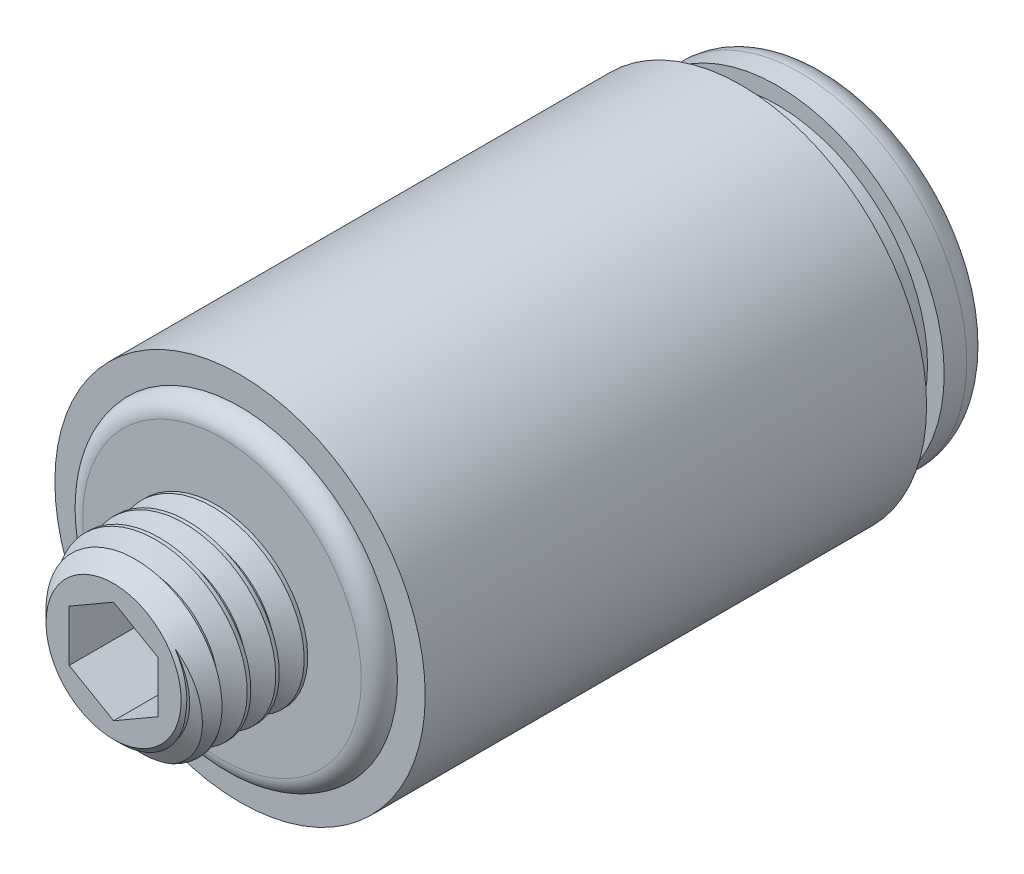
from build123d import *

# Parameters (mm, degrees)
SKETCH9_W          = 3.556
SKETCH9_H          = 2.5
CHAMFER1_SIZE      = 0.6
CUT_SWEEP2_PITCH   = 0.8
CUT_EXTRUDE1_DEPTH = 22.374518802


with BuildPart() as part:
    # Sketch8 → Revolve1 (revolve)
    with BuildSketch(Plane(origin=(0, 0, 0), x_dir=(0, 0, -1), z_dir=(1, 0, 0)), mode=Mode.PRIVATE) as revolve1_sk:
        with BuildLine():
            Line((18.669, 4.6863), (19.304, 4.6863))
            ThreePointArc((19.304, 4.6863), (19.842815367, 4.463115367), (20.066, 3.9243))
            Line((20.066, 3.9243), (20.066, 3.556))
            Line((20.066, 3.556), (19.685, 3.175))
            Line((19.685, 3.175), (3.556, 3.175))
            Line((3.556, 3.175), (3.556, 5.207))
            Line((3.556, 5.207), (17.653, 5.207))
            Line((17.653, 5.207), (17.653, 4.21767))
            Line((17.653, 4.21767), (18.669, 4.21767))
            Line((18.669, 4.21767), (18.669, 4.6863))
        make_face()
    revolve(revolve1_sk.sketch.rotate(Axis((0, 0, 0), (0, 0, -1)), 90), axis=Axis((0, 0, 0), (0, 0, -1)))



with BuildPart() as body_2:
    # Sketch9 → Revolve2 (revolve)
    with BuildSketch(Plane(origin=(0, 0, 0), x_dir=(0, 0, -1), z_dir=(1, 0, 0)), mode=Mode.PRIVATE) as revolve2_sk:
        with Locations((1.778, 1.25)):
            Rectangle(SKETCH9_W, SKETCH9_H)
    revolve(revolve2_sk.sketch.rotate(Axis((0, 0, 0), (0, 0, -1)), 90), axis=Axis((0, 0, 0), (0, 0, -1)))

    # Chamfer1
    chamfer1_edges = [body_2.edges().sort_by_distance(p)[0] for p in [
        (-2.5, 0, 0),
    ]]
    chamfer(chamfer1_edges, length=CHAMFER1_SIZE)

    # Cut-Sweep2: the profile of Sketch11 profile screwed along a right-hand helix of 5.445 turns, 8 arcs to a turn; built about Z, then put on its axis
    cut_sweep2_z = Axis((0, 0, 0), (0, 0, 1))
    cut_sweep2_corners = [(2.5003, 0, 0.000173205), (2.5003, 0, -0.700173205), (1.980384758, 0, -0.4), (1.980384758, 0, -0.3)]
    with BuildLine(mode=Mode.PRIVATE) as cut_sweep2_profile:
        Line(cut_sweep2_corners[0], cut_sweep2_corners[1])
        Line(cut_sweep2_corners[1], cut_sweep2_corners[2])
        Line(cut_sweep2_corners[2], cut_sweep2_corners[3])
        Line(cut_sweep2_corners[3], cut_sweep2_corners[0])
    cut_sweep2_cap = Face(cut_sweep2_profile.wire())
    cut_sweep2_turn_angles = [0, 22.5, 45, 67.5, 90, 112.5, 135, 157.5, 180, 202.5, 225, 247.5, 270, 292.5, 315, 337.5, 360]
    cut_sweep2_turn_weights = [1, 0.9238795325112867, 1, 0.9238795325112867, 1, 0.9238795325112867, 1, 0.9238795325112867, 1, 0.9238795325112867, 1, 0.9238795325112867, 1, 0.9238795325112867, 1, 0.9238795325112867, 1]
    cut_sweep2_turn_rails = [Edge.make_bspline([Vector(p[0], p[1], 0).rotate(cut_sweep2_z, cut_sweep2_turn_angles[k]) / cut_sweep2_turn_weights[k] + Vector(0, 0, p[2] + CUT_SWEEP2_PITCH * cut_sweep2_turn_angles[k] / 360) for k in range(17)], [0, 0, 0, 1, 1, 2, 2, 3, 3, 4, 4, 5, 5, 6, 6, 7, 7, 8, 8, 8], 2, cut_sweep2_turn_weights) for p in cut_sweep2_corners]
    cut_sweep2_turn_sides = [Face.make_surface_from_curves(cut_sweep2_turn_rails[p[0]], cut_sweep2_turn_rails[p[1]]) for p in [(0, 1), (1, 2), (2, 3), (3, 0)]]
    cut_sweep2_last_angles = [1800, 1822.5, 1845, 1867.5, 1890, 1912.5, 1935, 1947.6, 1960.2]
    cut_sweep2_last_weights = [1, 0.9238795325112867, 1, 0.9238795325112867, 1, 0.9238795325112867, 1, 0.9759167619387434, 1]
    cut_sweep2_last_rails = [Edge.make_bspline([Vector(p[0], p[1], 0).rotate(cut_sweep2_z, cut_sweep2_last_angles[k]) / cut_sweep2_last_weights[k] + Vector(0, 0, p[2] + CUT_SWEEP2_PITCH * cut_sweep2_last_angles[k] / 360) for k in range(9)], [0, 0, 0, 1, 1, 2, 2, 3, 3, 4, 4, 4], 2, cut_sweep2_last_weights) for p in cut_sweep2_corners]
    cut_sweep2_last_sides = [Face.make_surface_from_curves(cut_sweep2_last_rails[p[0]], cut_sweep2_last_rails[p[1]]) for p in [(0, 1), (1, 2), (2, 3), (3, 0)]]
    cut_sweep2 = Plane(origin=(0, 0, -3.556), x_dir=(0, 1, 0), z_dir=(0, 0, 1)) * Solid(Shell([*[p.moved(Location((0, 0, CUT_SWEEP2_PITCH * i))) for i in range(5) for p in cut_sweep2_turn_sides], *cut_sweep2_last_sides, cut_sweep2_cap, cut_sweep2_cap.rotate(cut_sweep2_z, 1960.2).moved(Location((0, 0, CUT_SWEEP2_PITCH * 1960.2 / 360)))]))
    add(cut_sweep2, mode=Mode.SUBTRACT)


with BuildPart() as part_1:
    add(part.part)

    add(body_2.part)  # Revolve3 merges body 2
    # Sketch14 → Revolve3 (revolve)
    with BuildSketch(Plane(origin=(0, 0, 0), x_dir=(0, 0, -1), z_dir=(1, 0, 0)), mode=Mode.PRIVATE) as revolve3_sk:
        with BuildLine():
            Line((3.556, 0), (3.556, 4.42595))
            ThreePointArc((3.556, 4.42595), (3.196789755, 4.277160245), (3.048, 3.91795))
            Line((3.048, 3.91795), (3.048, 0))
            Line((3.048, 0), (3.556, 0))
        make_face()
    revolve(revolve3_sk.sketch.rotate(Axis((0, 0, -3.048), (0, 0, -1)), 90), axis=Axis((0, 0, -3.048), (0, 0, -1)))

    # Sketch12 → Cut-Extrude1 (cut, through all)
    with BuildSketch(Plane.XY):
        Polygon((0, 1.443375673), (-1.25, 0.721687836), (-1.25, -0.721687836), (0, -1.443375673), (1.25, -0.721687836), (1.25, 0.721687836), align=None)
    extrude(amount=-CUT_EXTRUDE1_DEPTH, mode=Mode.SUBTRACT)


solid = part_1.part
